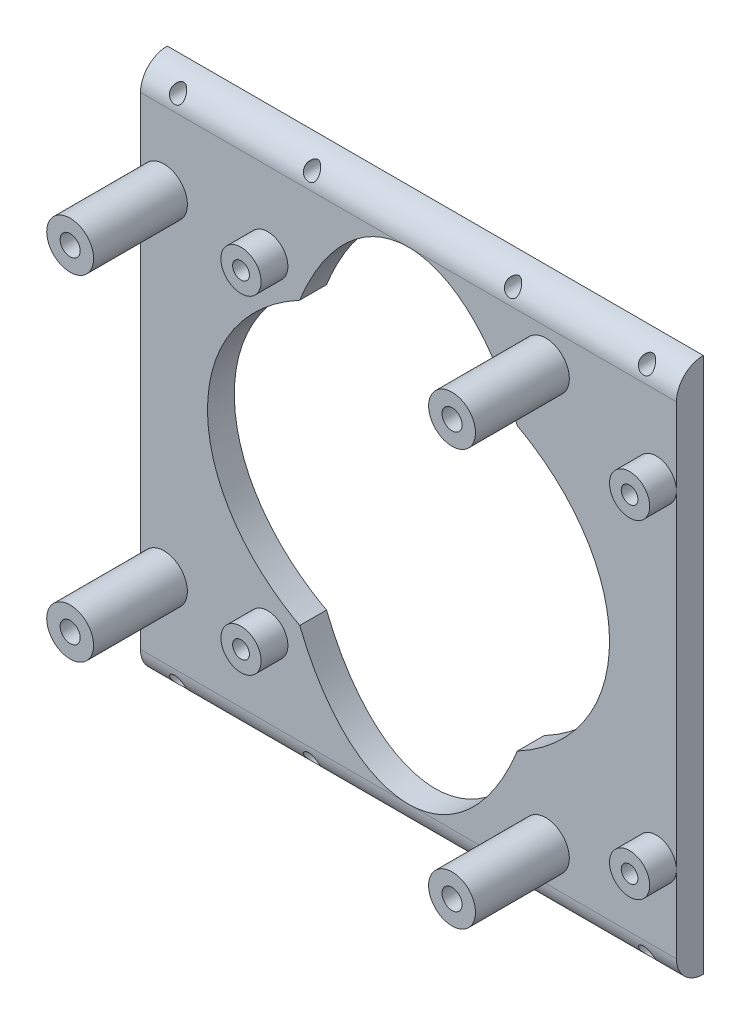
from build123d import *
from build123d.topology import SkipClean

# Parameters (mm, degrees)
CROQUIS1_W                 = 10
CROQUIS1_H                 = 10
CROQUIS1_R                 = 1.5
CROQUIS1_H_2               = 4
CROQUIS1_R_2               = 3
CROQUIS1_R_3               = 1.25
CROQUIS1_R_4               = 3.5
CROQUIS1_R_5               = 2.2
SALIENTE_EXTRUIR5_DEPTH    = 4
SALIENTE_EXTRUIR6_START    = 4
CROQUIS1_6_W               = 10
CROQUIS1_6_H               = 4
SALIENTE_EXTRUIR6_DEPTH    = 20.4
SALIENTE_EXTRUIR7_START    = 24.4
CROQUIS1_7_W               = 10
CROQUIS1_7_H               = 4
CROQUIS1_7_R               = 3
CROQUIS1_7_R_2             = 3.5
CROQUIS1_7_R_3             = 2.2
CROQUIS1_7_R_4             = 1.5
CROQUIS1_7_R_5             = 1.25
CROQUIS1_7_H_2             = 31
CROQUIS1_7_H_3             = 10
SALIENTE_EXTRUIR7_DEPTH    = 4
SALIENTE_EXTRUIR9_START    = 28.4
CROQUIS1_10_R              = 3
SALIENTE_EXTRUIR9_DEPTH    = 4
SALIENTE_EXTRUIR10_START   = 28.4
CROQUIS1_11_R              = 3.5
SALIENTE_EXTRUIR10_DEPTH   = 14
CORTAR_EXTRUIR1_DEPTH      = 14
CORTAR_EXTRUIR1_DEPTH_BACK = 14
CORTAR_EXTRUIR1_START      = 28.4
CROQUIS1_12_R              = 1.5
CROQUIS1_12_R_2            = 1.25
CORTAR_EXTRUIR2_START      = 24.4
CROQUIS1_13_R              = 2.2
CORTAR_EXTRUIR2_DEPTH      = 15
REDONDEO2_RADIUS           = 5
REDONDEO2_LENGTH           = 4
REDONDEO3_RADIUS           = 5
REDONDEO3_LENGTH           = 4
REDONDEO4_RADIUS           = 5
REDONDEO4_LENGTH           = 4
REDONDEO5_RADIUS           = 5
REDONDEO5_LENGTH           = 4
REDONDEO6_R                = 4
REDONDEO7_R                = 4
CORTAR_EXTRUIR6_START      = 28.4
CROQUIS2_RX                = 30
CROQUIS2_RY                = 25
CROQUIS2_RX_2              = 36
CROQUIS2_RY_2              = 20
CORTAR_EXTRUIR6_DEPTH      = 8
CORTAR_EXTRUIR7_DEPTH      = 10
CORTAR_EXTRUIR7_DEPTH_BACK = 90
CROQUIS3_W                 = 80
CROQUIS3_H                 = 24.4
CROQUIS4_R                 = 1.1
CORTAR_EXTRUIR8_DEPTH      = 17


with BuildPart() as part:
    # Croquis1 → Saliente-Extruir5 (new body)
    # profile 1 of 42: a face of its own
    with SkipClean():  # the faces are left unmerged after this step: merging them gives an invalid solid
        with BuildSketch(Plane.XY):
            with Locations((-45.946521078, 63.070175439)):
                Rectangle(CROQUIS1_W, CROQUIS1_H)
            with Locations((-45.946521078, 63.070175439)):
                Circle(CROQUIS1_R, mode=Mode.SUBTRACT)
        # profile 2 of 42: a face of its own
        with BuildSketch(Plane.XY):
            with Locations((24.053478922, 63.070175439)):
                Rectangle(CROQUIS1_W, CROQUIS1_H)
            with Locations((24.053478922, 63.070175439)):
                Circle(CROQUIS1_R, mode=Mode.SUBTRACT)
        # profile 3 of 42: a face of its own
        with BuildSketch(Plane.XY):
            with Locations((24.053478922, -26.929824561)):
                Rectangle(CROQUIS1_W, CROQUIS1_H)
            with Locations((24.053478922, -26.929824561)):
                Circle(CROQUIS1_R, mode=Mode.SUBTRACT)
        # profile 4 of 42: a face of its own
        with BuildSketch(Plane.XY):
            with Locations((-45.946521078, -26.929824561)):
                Rectangle(CROQUIS1_W, CROQUIS1_H)
            with Locations((-45.946521078, -26.929824561)):
                Circle(CROQUIS1_R, mode=Mode.SUBTRACT)
        # profile 5 of 42: a face of its own
        with BuildSketch(Plane.XY):
            with Locations((-45.946521078, -19.929824561)):
                Rectangle(CROQUIS1_W, CROQUIS1_H_2)
        # profile 6 of 42: a face of its own
        with BuildSketch(Plane.XY):
            with Locations((-35.946521078, -19.929824561)):
                Rectangle(CROQUIS1_W, CROQUIS1_H_2)
        # profile 7 of 42: a face of its own
        with BuildSketch(Plane.XY):
            with Locations((-25.946521078, -19.929824561)):
                Rectangle(CROQUIS1_W, CROQUIS1_H_2)
        # profile 8 of 42: a face of its own
        with BuildSketch(Plane.XY):
            with Locations((-15.946521078, -19.929824561)):
                Rectangle(CROQUIS1_W, CROQUIS1_H_2)
        # profile 9 of 42: a face of its own
        with BuildSketch(Plane.XY):
            with Locations((-5.946521078, -19.929824561)):
                Rectangle(CROQUIS1_W, CROQUIS1_H_2)
        # profile 10 of 42: a face of its own
        with BuildSketch(Plane.XY):
            with Locations((4.053478922, -19.929824561)):
                Rectangle(CROQUIS1_W, CROQUIS1_H_2)
        # profile 11 of 42: a face of its own
        with BuildSketch(Plane.XY):
            with Locations((14.053478922, -19.929824561)):
                Rectangle(CROQUIS1_W, CROQUIS1_H_2)
        # profile 12 of 42: a face of its own
        with BuildSketch(Plane.XY):
            with Locations((24.053478922, -19.929824561)):
                Rectangle(CROQUIS1_W, CROQUIS1_H_2)
        # profile 13 of 42: a face of its own
        with BuildSketch(Plane.XY):
            Polygon((29.053478922, 13.070175439), (19.053478922, 13.070175439), (19.053478922, -17.929824561), (29.053478922, -17.929824561), (29.053478922, -6.429824561), align=None)
            with Locations((26.053478922, -6.429824561)):
                Circle(CROQUIS1_R_2, mode=Mode.SUBTRACT)
        # profile 14 of 42: a face of its own
        with BuildSketch(Plane.XY):
            with Locations((26.053478922, -6.429824561)):
                Circle(CROQUIS1_R_2)
            with Locations((26.053478922, -6.429824561)):
                Circle(CROQUIS1_R_3, mode=Mode.SUBTRACT)
        # profile 15 of 42: a face of its own
        with BuildSketch(Plane.XY):
            with Locations((26.053478922, -6.429824561)):
                Circle(CROQUIS1_R_3)
        # profile 16 of 42: a face of its own
        with BuildSketch(Plane.XY):
            Polygon((-40.946521078, -17.929824561), (-40.946521078, 13.070175439), (-50.946521078, 13.070175439), (-50.946521078, -6.929824541), (-50.946521078, -17.929824561), align=None)
            with BuildLine():
                ThreePointArc((-43.946521078, -6.929824561), (-47.446521088, -10.429824561), (-50.946521078, -6.929824541))
                ThreePointArc((-50.946521078, -6.929824541), (-47.446521067, -3.429824561), (-43.946521078, -6.929824561))
            make_face(mode=Mode.SUBTRACT)
        # profile 17 of 42: a face of its own
        with BuildSketch(Plane.XY):
            with Locations((-47.446521078, -6.929824561)):
                Circle(CROQUIS1_R_4)
            with Locations((-47.446521078, -6.929824561)):
                Circle(CROQUIS1_R_5, mode=Mode.SUBTRACT)
        # profile 18 of 42: a face of its own
        with BuildSketch(Plane.XY):
            with Locations((-47.446521078, -6.929824561)):
                Circle(CROQUIS1_R_5)
            with Locations((-47.446521078, -6.929824561)):
                Circle(CROQUIS1_R, mode=Mode.SUBTRACT)
        # profile 19 of 42: a face of its own
        with BuildSketch(Plane.XY):
            with Locations((-47.446521078, -6.929824561)):
                Circle(CROQUIS1_R)
        # profile 20 of 42: a face of its own
        with BuildSketch(Plane.XY):
            with Locations((-45.946521078, 18.070175439)):
                Rectangle(CROQUIS1_W, CROQUIS1_H)
        # profile 21 of 42: a face of its own
        with BuildSketch(Plane.XY):
            with Locations((-35.946521078, 18.070175439)):
                Rectangle(CROQUIS1_W, CROQUIS1_H)
        # profile 22 of 42: a face of its own
        with BuildSketch(Plane.XY):
            with Locations((-25.946521078, 18.070175439)):
                Rectangle(CROQUIS1_W, CROQUIS1_H)
        # profile 23 of 42: a face of its own
        with BuildSketch(Plane.XY):
            with Locations((-15.946521078, 18.070175439)):
                Rectangle(CROQUIS1_W, CROQUIS1_H)
        # profile 24 of 42: a face of its own
        with BuildSketch(Plane.XY):
            with Locations((-5.946521078, 18.070175439)):
                Rectangle(CROQUIS1_W, CROQUIS1_H)
        # profile 25 of 42: a face of its own
        with BuildSketch(Plane.XY):
            with Locations((4.053478922, 18.070175439)):
                Rectangle(CROQUIS1_W, CROQUIS1_H)
        # profile 26 of 42: a face of its own
        with BuildSketch(Plane.XY):
            with Locations((14.053478922, 18.070175439)):
                Rectangle(CROQUIS1_W, CROQUIS1_H)
        # profile 27 of 42: a face of its own
        with BuildSketch(Plane.XY):
            with Locations((24.053478922, 18.070175439)):
                Rectangle(CROQUIS1_W, CROQUIS1_H)
        # profile 28 of 42: a face of its own
        with BuildSketch(Plane.XY):
            Polygon((-40.946521078, 54.070175439), (-50.946521078, 54.070175439), (-50.946521078, 43.070175439), (-50.946521078, 23.070175439), (-40.946521078, 23.070175439), align=None)
            with BuildLine():
                ThreePointArc((-43.946521078, 43.070175439), (-47.446521078, 39.570175439), (-50.946521078, 43.070175439))
                ThreePointArc((-50.946521078, 43.070175439), (-47.446521078, 46.570175439), (-43.946521078, 43.070175439))
            make_face(mode=Mode.SUBTRACT)
        # profile 29 of 42: a face of its own
        with BuildSketch(Plane.XY):
            with Locations((-45.946521078, 56.070175439)):
                Rectangle(CROQUIS1_W, CROQUIS1_H_2)
        # profile 30 of 42: a face of its own
        with BuildSketch(Plane.XY):
            with Locations((-47.446521078, 43.070175439)):
                Circle(CROQUIS1_R_4)
            with Locations((-47.446521078, 43.070175439)):
                Circle(CROQUIS1_R_5, mode=Mode.SUBTRACT)
        # profile 31 of 42: a face of its own
        with BuildSketch(Plane.XY):
            with Locations((-47.446521078, 43.070175439)):
                Circle(CROQUIS1_R_5)
            with Locations((-47.446521078, 43.070175439)):
                Circle(CROQUIS1_R, mode=Mode.SUBTRACT)
        # profile 32 of 42: a face of its own
        with BuildSketch(Plane.XY):
            with Locations((-47.446521078, 43.070175439)):
                Circle(CROQUIS1_R)
        # profile 33 of 42: a face of its own
        with BuildSketch(Plane.XY):
            with Locations((-35.946521078, 56.070175439)):
                Rectangle(CROQUIS1_W, CROQUIS1_H_2)
        # profile 34 of 42: a face of its own
        with BuildSketch(Plane.XY):
            with Locations((-25.946521078, 56.070175439)):
                Rectangle(CROQUIS1_W, CROQUIS1_H_2)
        # profile 35 of 42: a face of its own
        with BuildSketch(Plane.XY):
            with Locations((-15.946521078, 56.070175439)):
                Rectangle(CROQUIS1_W, CROQUIS1_H_2)
        # profile 36 of 42: a face of its own
        with BuildSketch(Plane.XY):
            with Locations((-5.946521078, 56.070175439)):
                Rectangle(CROQUIS1_W, CROQUIS1_H_2)
        # profile 37 of 42: a face of its own
        with BuildSketch(Plane.XY):
            with Locations((4.053478922, 56.070175439)):
                Rectangle(CROQUIS1_W, CROQUIS1_H_2)
        # profile 38 of 42: a face of its own
        with BuildSketch(Plane.XY):
            with Locations((14.053478922, 56.070175439)):
                Rectangle(CROQUIS1_W, CROQUIS1_H_2)
        # profile 39 of 42: a face of its own
        with BuildSketch(Plane.XY):
            with Locations((24.053478922, 56.070175439)):
                Rectangle(CROQUIS1_W, CROQUIS1_H_2)
        # profile 40 of 42: a face of its own
        with BuildSketch(Plane.XY):
            Polygon((29.053478922, 54.070175439), (19.053478922, 54.070175439), (19.053478922, 23.070175439), (29.053478922, 23.070175439), (29.053478922, 42.570175439), align=None)
            with Locations((26.053478922, 42.570175439)):
                Circle(CROQUIS1_R_2, mode=Mode.SUBTRACT)
        # profile 41 of 42: a face of its own
        with BuildSketch(Plane.XY):
            with Locations((26.053478922, 42.570175439)):
                Circle(CROQUIS1_R_2)
            with Locations((26.053478922, 42.570175439)):
                Circle(CROQUIS1_R_3, mode=Mode.SUBTRACT)
        # profile 42 of 42: a face of its own
        with BuildSketch(Plane.XY):
            with Locations((26.053478922, 42.570175439)):
                Circle(CROQUIS1_R_3)
        extrude(amount=SALIENTE_EXTRUIR5_DEPTH)

    # Croquis1<6> → Saliente-Extruir6 (add)
    with BuildSketch(Plane.XY.offset(SALIENTE_EXTRUIR6_START)):
        with Locations((-45.946521078, 56.070175439)):
            Rectangle(CROQUIS1_6_W, CROQUIS1_6_H)
        with Locations((-25.946521078, 56.070175439)):
            Rectangle(CROQUIS1_6_W, CROQUIS1_6_H)
        with Locations((24.053478922, 56.070175439)):
            Rectangle(CROQUIS1_6_W, CROQUIS1_6_H)
        with Locations((4.053478922, 56.070175439)):
            Rectangle(CROQUIS1_6_W, CROQUIS1_6_H)
        with Locations((-45.946521078, -19.929824561)):
            Rectangle(CROQUIS1_6_W, CROQUIS1_6_H)
        with Locations((-25.946521078, -19.929824561)):
            Rectangle(CROQUIS1_6_W, CROQUIS1_6_H)
        with Locations((4.053478922, -19.929824561)):
            Rectangle(CROQUIS1_6_W, CROQUIS1_6_H)
        with Locations((24.053478922, -19.929824561)):
            Rectangle(CROQUIS1_6_W, CROQUIS1_6_H)
    extrude(amount=SALIENTE_EXTRUIR6_DEPTH)

    # Croquis1<7> → Saliente-Extruir7 (add)
    # profile 1 of 90: a face of its own
    with SkipClean():  # the faces are left unmerged after this step: merging them gives an invalid solid
        with BuildSketch(Plane.XY.offset(SALIENTE_EXTRUIR7_START)):
            with Locations((-45.946521078, 56.070175439)):
                Rectangle(CROQUIS1_7_W, CROQUIS1_7_H)
        # profile 2 of 90: a face of its own
        with BuildSketch(Plane.XY.offset(SALIENTE_EXTRUIR7_START)):
            with Locations((-35.946521078, 56.070175439)):
                Rectangle(CROQUIS1_7_W, CROQUIS1_7_H)
        # profile 3 of 90: a face of its own
        with BuildSketch(Plane.XY.offset(SALIENTE_EXTRUIR7_START)):
            with Locations((-15.946521078, 56.070175439)):
                Rectangle(CROQUIS1_7_W, CROQUIS1_7_H)
        # profile 4 of 90: a face of its own
        with BuildSketch(Plane.XY.offset(SALIENTE_EXTRUIR7_START)):
            with Locations((-5.946521078, 56.070175439)):
                Rectangle(CROQUIS1_7_W, CROQUIS1_7_H)
        # profile 5 of 90: a face of its own
        with BuildSketch(Plane.XY.offset(SALIENTE_EXTRUIR7_START)):
            with Locations((4.053478922, 56.070175439)):
                Rectangle(CROQUIS1_7_W, CROQUIS1_7_H)
        # profile 6 of 90: a face of its own
        with BuildSketch(Plane.XY.offset(SALIENTE_EXTRUIR7_START)):
            with Locations((-25.946521078, 56.070175439)):
                Rectangle(CROQUIS1_7_W, CROQUIS1_7_H)
        # profile 7 of 90: a face of its own
        with BuildSketch(Plane.XY.offset(SALIENTE_EXTRUIR7_START)):
            with Locations((14.053478922, 56.070175439)):
                Rectangle(CROQUIS1_7_W, CROQUIS1_7_H)
        # profile 8 of 90: a face of its own
        with BuildSketch(Plane.XY.offset(SALIENTE_EXTRUIR7_START)):
            Polygon((29.053478922, 54.070175439), (19.053478922, 54.070175439), (19.053478922, 23.070175439), (29.053478922, 23.070175439), (29.053478922, 42.570175439), align=None)
            with Locations((26.053478922, 42.570175439)):
                Circle(CROQUIS1_7_R, mode=Mode.SUBTRACT)
        # profile 9 of 90: a face of its own
        with BuildSketch(Plane.XY.offset(SALIENTE_EXTRUIR7_START)):
            Polygon((-40.946521078, 54.070175439), (-50.946521078, 54.070175439), (-50.946521078, 43.070175439), (-50.946521078, 23.070175439), (-40.946521078, 23.070175439), align=None)
            with BuildLine():
                ThreePointArc((-43.946521078, 43.070175439), (-47.446521078, 39.570175439), (-50.946521078, 43.070175439))
                ThreePointArc((-50.946521078, 43.070175439), (-47.446521078, 46.570175439), (-43.946521078, 43.070175439))
            make_face(mode=Mode.SUBTRACT)
        # profile 10 of 90: a face of its own
        with BuildSketch(Plane.XY.offset(SALIENTE_EXTRUIR7_START)):
            with BuildLine():
                Line((-30.946521078, 54.070175439), (-40.946521078, 54.070175439))
                Line((-40.946521078, 54.070175439), (-40.946521078, 23.070175439))
                Line((-40.946521078, 23.070175439), (-30.946521078, 23.070175439))
                Line((-30.946521078, 23.070175439), (-30.946521078, 39.741748314))
                ThreePointArc((-30.946521078, 39.741748314), (-34.946521078, 42.570175439), (-30.946521078, 45.398602563))
                Line((-30.946521078, 45.398602563), (-30.946521078, 54.070175439))
            make_face()
        # profile 11 of 90: a face of its own
        with BuildSketch(Plane.XY.offset(SALIENTE_EXTRUIR7_START)):
            with Locations((-47.446521078, 43.070175439)):
                Circle(CROQUIS1_7_R_2)
            with Locations((-47.446521078, 43.070175439)):
                Circle(CROQUIS1_7_R_3, mode=Mode.SUBTRACT)
        # profile 12 of 90: a face of its own
        with BuildSketch(Plane.XY.offset(SALIENTE_EXTRUIR7_START)):
            with Locations((-47.446521078, 43.070175439)):
                Circle(CROQUIS1_7_R_3)
            with Locations((-47.446521078, 43.070175439)):
                Circle(CROQUIS1_7_R_4, mode=Mode.SUBTRACT)
        # profile 13 of 90: a face of its own
        with BuildSketch(Plane.XY.offset(SALIENTE_EXTRUIR7_START)):
            with Locations((-47.446521078, 43.070175439)):
                Circle(CROQUIS1_7_R_4)
        # profile 14 of 90: a face of its own
        with BuildSketch(Plane.XY.offset(SALIENTE_EXTRUIR7_START)):
            with Locations((26.053478922, 42.570175439)):
                Circle(CROQUIS1_7_R)
            with Locations((26.053478922, 42.570175439)):
                Circle(CROQUIS1_7_R_5, mode=Mode.SUBTRACT)
        # profile 15 of 90: a face of its own
        with BuildSketch(Plane.XY.offset(SALIENTE_EXTRUIR7_START)):
            with Locations((26.053478922, 42.570175439)):
                Circle(CROQUIS1_7_R_5)
        # profile 16 of 90: a face of its own
        with BuildSketch(Plane.XY.offset(SALIENTE_EXTRUIR7_START)):
            with Locations((24.053478922, 56.070175439)):
                Rectangle(CROQUIS1_7_W, CROQUIS1_7_H)
        # profile 17 of 90: a face of its own
        with BuildSketch(Plane.XY.offset(SALIENTE_EXTRUIR7_START)):
            with BuildLine():
                ThreePointArc((-28.946521078, 42.570175439), (-29.497031335, 44.302226246), (-30.946521078, 45.398602563))
                Line((-30.946521078, 45.398602563), (-30.946521078, 43.320175439))
                ThreePointArc((-30.946521078, 43.320175439), (-30.760666955, 42.965460146), (-30.696521078, 42.570175439))
                ThreePointArc((-30.696521078, 42.570175439), (-30.760666955, 42.174890731), (-30.946521078, 41.820175439))
                Line((-30.946521078, 41.820175439), (-30.946521078, 39.741748314))
                ThreePointArc((-30.946521078, 39.741748314), (-29.497031335, 40.838124631), (-28.946521078, 42.570175439))
            make_face()
        # profile 18 of 90: a face of its own
        with BuildSketch(Plane.XY.offset(SALIENTE_EXTRUIR7_START)):
            with BuildLine():
                Line((-30.946521078, 43.320175439), (-30.946521078, 45.398602563))
                ThreePointArc((-30.946521078, 45.398602563), (-34.946521078, 42.570175439), (-30.946521078, 39.741748314))
                Line((-30.946521078, 39.741748314), (-30.946521078, 41.820175439))
                ThreePointArc((-30.946521078, 41.820175439), (-33.196521078, 42.570175439), (-30.946521078, 43.320175439))
            make_face()
        # profile 19 of 90: a face of its own
        with BuildSketch(Plane.XY.offset(SALIENTE_EXTRUIR7_START)):
            with BuildLine():
                ThreePointArc((-30.696521078, 42.570175439), (-30.760666955, 42.965460146), (-30.946521078, 43.320175439))
                Line((-30.946521078, 43.320175439), (-30.946521078, 41.820175439))
                ThreePointArc((-30.946521078, 41.820175439), (-30.760666955, 42.174890731), (-30.696521078, 42.570175439))
            make_face()
        # profile 20 of 90: a face of its own
        with BuildSketch(Plane.XY.offset(SALIENTE_EXTRUIR7_START)):
            with BuildLine():
                Line((-30.946521078, 41.820175439), (-30.946521078, 43.320175439))
                ThreePointArc((-30.946521078, 43.320175439), (-33.196521078, 42.570175439), (-30.946521078, 41.820175439))
            make_face()
        # profile 21 of 90: a face of its own
        with BuildSketch(Plane.XY.offset(SALIENTE_EXTRUIR7_START)):
            with BuildLine():
                ThreePointArc((-28.946521078, 42.570175439), (-29.497031335, 44.302226246), (-30.946521078, 45.398602563))
                Line((-30.946521078, 45.398602563), (-30.946521078, 43.320175439))
                ThreePointArc((-30.946521078, 43.320175439), (-30.760666955, 42.965460146), (-30.696521078, 42.570175439))
                ThreePointArc((-30.696521078, 42.570175439), (-30.760666955, 42.174890731), (-30.946521078, 41.820175439))
                Line((-30.946521078, 41.820175439), (-30.946521078, 39.741748314))
                ThreePointArc((-30.946521078, 39.741748314), (-29.497031335, 40.838124631), (-28.946521078, 42.570175439))
            make_face()
        # profile 22 of 90: a face of its own
        with BuildSketch(Plane.XY.offset(SALIENTE_EXTRUIR7_START)):
            with BuildLine():
                Line((-30.946521078, 43.320175439), (-30.946521078, 45.398602563))
                ThreePointArc((-30.946521078, 45.398602563), (-34.946521078, 42.570175439), (-30.946521078, 39.741748314))
                Line((-30.946521078, 39.741748314), (-30.946521078, 41.820175439))
                ThreePointArc((-30.946521078, 41.820175439), (-33.196521078, 42.570175439), (-30.946521078, 43.320175439))
            make_face()
        # profile 23 of 90: a face of its own
        with BuildSketch(Plane.XY.offset(SALIENTE_EXTRUIR7_START)):
            with BuildLine():
                ThreePointArc((-30.696521078, 42.570175439), (-30.760666955, 42.965460146), (-30.946521078, 43.320175439))
                Line((-30.946521078, 43.320175439), (-30.946521078, 41.820175439))
                ThreePointArc((-30.946521078, 41.820175439), (-30.760666955, 42.174890731), (-30.696521078, 42.570175439))
            make_face()
        # profile 24 of 90: a face of its own
        with BuildSketch(Plane.XY.offset(SALIENTE_EXTRUIR7_START)):
            with BuildLine():
                Line((-30.946521078, 41.820175439), (-30.946521078, 43.320175439))
                ThreePointArc((-30.946521078, 43.320175439), (-33.196521078, 42.570175439), (-30.946521078, 41.820175439))
            make_face()
        # profile 25 of 90: a face of its own
        with BuildSketch(Plane.XY.offset(SALIENTE_EXTRUIR7_START)):
            with BuildLine():
                Line((-20.946521078, 54.070175439), (-30.946521078, 54.070175439))
                Line((-30.946521078, 54.070175439), (-30.946521078, 45.398602563))
                ThreePointArc((-30.946521078, 45.398602563), (-29.497031335, 44.302226246), (-28.946521078, 42.570175439))
                ThreePointArc((-28.946521078, 42.570175439), (-29.497031335, 40.838124631), (-30.946521078, 39.741748314))
                Line((-30.946521078, 39.741748314), (-30.946521078, 23.070175439))
                Line((-30.946521078, 23.070175439), (-20.946521078, 23.070175439))
                Line((-20.946521078, 23.070175439), (-20.946521078, 54.070175439))
            make_face()
        # profile 26 of 90: a face of its own
        with BuildSketch(Plane.XY.offset(SALIENTE_EXTRUIR7_START)):
            with Locations((-15.946521078, 38.570175439)):
                Rectangle(CROQUIS1_7_W, CROQUIS1_7_H_2)
        # profile 27 of 90: a face of its own
        with BuildSketch(Plane.XY.offset(SALIENTE_EXTRUIR7_START)):
            with Locations((-5.946521078, 38.570175439)):
                Rectangle(CROQUIS1_7_W, CROQUIS1_7_H_2)
        # profile 28 of 90: a face of its own
        with BuildSketch(Plane.XY.offset(SALIENTE_EXTRUIR7_START)):
            with BuildLine():
                Line((9.053478922, 54.070175439), (-0.946521078, 54.070175439))
                Line((-0.946521078, 54.070175439), (-0.946521078, 23.070175439))
                Line((-0.946521078, 23.070175439), (9.053478922, 23.070175439))
                Line((9.053478922, 23.070175439), (9.053478922, 45.606073823))
                ThreePointArc((9.053478922, 45.606073823), (6.053478922, 49.070175439), (9.053478922, 52.534277054))
                Line((9.053478922, 52.534277054), (9.053478922, 54.070175439))
            make_face()
        # profile 29 of 90: a face of its own
        with BuildSketch(Plane.XY.offset(SALIENTE_EXTRUIR7_START)):
            with BuildLine():
                ThreePointArc((13.053478922, 49.070175439), (11.84476677, 51.71592675), (9.053478922, 52.534277054))
                Line((9.053478922, 52.534277054), (9.053478922, 51.212603967))
                ThreePointArc((9.053478922, 51.212603967), (10.920958355, 50.793544233), (11.753478922, 49.070175439))
                ThreePointArc((11.753478922, 49.070175439), (10.920958355, 47.346806645), (9.053478922, 46.92774691))
                Line((9.053478922, 46.92774691), (9.053478922, 45.606073823))
                ThreePointArc((9.053478922, 45.606073823), (11.84476677, 46.424424128), (13.053478922, 49.070175439))
            make_face()
        # profile 30 of 90: a face of its own
        with BuildSketch(Plane.XY.offset(SALIENTE_EXTRUIR7_START)):
            with BuildLine():
                Line((9.053478922, 51.212603967), (9.053478922, 52.534277054))
                ThreePointArc((9.053478922, 52.534277054), (6.053478922, 49.070175439), (9.053478922, 45.606073823))
                Line((9.053478922, 45.606073823), (9.053478922, 46.92774691))
                ThreePointArc((9.053478922, 46.92774691), (7.353478922, 49.070175439), (9.053478922, 51.212603967))
            make_face()
        # profile 31 of 90: a face of its own
        with BuildSketch(Plane.XY.offset(SALIENTE_EXTRUIR7_START)):
            with BuildLine():
                ThreePointArc((11.753478922, 49.070175439), (10.920958355, 50.793544233), (9.053478922, 51.212603967))
                Line((9.053478922, 51.212603967), (9.053478922, 50.484389001))
                ThreePointArc((9.053478922, 50.484389001), (10.419504326, 50.29492031), (11.053478922, 49.070175439))
                ThreePointArc((11.053478922, 49.070175439), (10.419504326, 47.845430567), (9.053478922, 47.655961876))
                Line((9.053478922, 47.655961876), (9.053478922, 46.92774691))
                ThreePointArc((9.053478922, 46.92774691), (10.920958355, 47.346806645), (11.753478922, 49.070175439))
            make_face()
        # profile 32 of 90: a face of its own
        with BuildSketch(Plane.XY.offset(SALIENTE_EXTRUIR7_START)):
            with BuildLine():
                Line((9.053478922, 50.484389001), (9.053478922, 51.212603967))
                ThreePointArc((9.053478922, 51.212603967), (7.353478922, 49.070175439), (9.053478922, 46.92774691))
                Line((9.053478922, 46.92774691), (9.053478922, 47.655961876))
                ThreePointArc((9.053478922, 47.655961876), (8.053478922, 49.070175439), (9.053478922, 50.484389001))
            make_face()
        # profile 33 of 90: a face of its own
        with BuildSketch(Plane.XY.offset(SALIENTE_EXTRUIR7_START)):
            with BuildLine():
                ThreePointArc((11.053478922, 49.070175439), (10.419504326, 50.29492031), (9.053478922, 50.484389001))
                Line((9.053478922, 50.484389001), (9.053478922, 47.655961876))
                ThreePointArc((9.053478922, 47.655961876), (10.419504326, 47.845430567), (11.053478922, 49.070175439))
            make_face()
        # profile 34 of 90: a face of its own
        with BuildSketch(Plane.XY.offset(SALIENTE_EXTRUIR7_START)):
            with BuildLine():
                Line((9.053478922, 47.655961876), (9.053478922, 50.484389001))
                ThreePointArc((9.053478922, 50.484389001), (8.053478922, 49.070175439), (9.053478922, 47.655961876))
            make_face()
        # profile 35 of 90: a face of its own
        with BuildSketch(Plane.XY.offset(SALIENTE_EXTRUIR7_START)):
            with BuildLine():
                ThreePointArc((11.053478922, 49.070175439), (10.419504326, 50.29492031), (9.053478922, 50.484389001))
                Line((9.053478922, 50.484389001), (9.053478922, 47.655961876))
                ThreePointArc((9.053478922, 47.655961876), (10.419504326, 47.845430567), (11.053478922, 49.070175439))
            make_face()
        # profile 36 of 90: a face of its own
        with BuildSketch(Plane.XY.offset(SALIENTE_EXTRUIR7_START)):
            with BuildLine():
                Line((9.053478922, 47.655961876), (9.053478922, 50.484389001))
                ThreePointArc((9.053478922, 50.484389001), (8.053478922, 49.070175439), (9.053478922, 47.655961876))
            make_face()
        # profile 37 of 90: a face of its own
        with BuildSketch(Plane.XY.offset(SALIENTE_EXTRUIR7_START)):
            with BuildLine():
                ThreePointArc((11.753478922, 49.070175439), (10.920958355, 50.793544233), (9.053478922, 51.212603967))
                Line((9.053478922, 51.212603967), (9.053478922, 50.484389001))
                ThreePointArc((9.053478922, 50.484389001), (10.419504326, 50.29492031), (11.053478922, 49.070175439))
                ThreePointArc((11.053478922, 49.070175439), (10.419504326, 47.845430567), (9.053478922, 47.655961876))
                Line((9.053478922, 47.655961876), (9.053478922, 46.92774691))
                ThreePointArc((9.053478922, 46.92774691), (10.920958355, 47.346806645), (11.753478922, 49.070175439))
            make_face()
        # profile 38 of 90: a face of its own
        with BuildSketch(Plane.XY.offset(SALIENTE_EXTRUIR7_START)):
            with BuildLine():
                Line((9.053478922, 50.484389001), (9.053478922, 51.212603967))
                ThreePointArc((9.053478922, 51.212603967), (7.353478922, 49.070175439), (9.053478922, 46.92774691))
                Line((9.053478922, 46.92774691), (9.053478922, 47.655961876))
                ThreePointArc((9.053478922, 47.655961876), (8.053478922, 49.070175439), (9.053478922, 50.484389001))
            make_face()
        # profile 39 of 90: a face of its own
        with BuildSketch(Plane.XY.offset(SALIENTE_EXTRUIR7_START)):
            with BuildLine():
                ThreePointArc((13.053478922, 49.070175439), (11.84476677, 51.71592675), (9.053478922, 52.534277054))
                Line((9.053478922, 52.534277054), (9.053478922, 51.212603967))
                ThreePointArc((9.053478922, 51.212603967), (10.920958355, 50.793544233), (11.753478922, 49.070175439))
                ThreePointArc((11.753478922, 49.070175439), (10.920958355, 47.346806645), (9.053478922, 46.92774691))
                Line((9.053478922, 46.92774691), (9.053478922, 45.606073823))
                ThreePointArc((9.053478922, 45.606073823), (11.84476677, 46.424424128), (13.053478922, 49.070175439))
            make_face()
        # profile 40 of 90: a face of its own
        with BuildSketch(Plane.XY.offset(SALIENTE_EXTRUIR7_START)):
            with BuildLine():
                Line((9.053478922, 51.212603967), (9.053478922, 52.534277054))
                ThreePointArc((9.053478922, 52.534277054), (6.053478922, 49.070175439), (9.053478922, 45.606073823))
                Line((9.053478922, 45.606073823), (9.053478922, 46.92774691))
                ThreePointArc((9.053478922, 46.92774691), (7.353478922, 49.070175439), (9.053478922, 51.212603967))
            make_face()
        # profile 41 of 90: a face of its own
        with BuildSketch(Plane.XY.offset(SALIENTE_EXTRUIR7_START)):
            with BuildLine():
                Line((19.053478922, 54.070175439), (9.053478922, 54.070175439))
                Line((9.053478922, 54.070175439), (9.053478922, 52.534277054))
                ThreePointArc((9.053478922, 52.534277054), (11.84476677, 51.71592675), (13.053478922, 49.070175439))
                ThreePointArc((13.053478922, 49.070175439), (11.84476677, 46.424424128), (9.053478922, 45.606073823))
                Line((9.053478922, 45.606073823), (9.053478922, 23.070175439))
                Line((9.053478922, 23.070175439), (19.053478922, 23.070175439))
                Line((19.053478922, 23.070175439), (19.053478922, 54.070175439))
            make_face()
        # profile 42 of 90: a face of its own
        with BuildSketch(Plane.XY.offset(SALIENTE_EXTRUIR7_START)):
            with Locations((24.053478922, 18.070175439)):
                Rectangle(CROQUIS1_7_W, CROQUIS1_7_H_3)
        # profile 43 of 90: a face of its own
        with BuildSketch(Plane.XY.offset(SALIENTE_EXTRUIR7_START)):
            with Locations((14.053478922, 18.070175439)):
                Rectangle(CROQUIS1_7_W, CROQUIS1_7_H_3)
        # profile 44 of 90: a face of its own
        with BuildSketch(Plane.XY.offset(SALIENTE_EXTRUIR7_START)):
            with Locations((4.053478922, 18.070175439)):
                Rectangle(CROQUIS1_7_W, CROQUIS1_7_H_3)
        # profile 45 of 90: a face of its own
        with BuildSketch(Plane.XY.offset(SALIENTE_EXTRUIR7_START)):
            with Locations((-5.946521078, 18.070175439)):
                Rectangle(CROQUIS1_7_W, CROQUIS1_7_H_3)
        # profile 46 of 90: a face of its own
        with BuildSketch(Plane.XY.offset(SALIENTE_EXTRUIR7_START)):
            with Locations((-15.946521078, 18.070175439)):
                Rectangle(CROQUIS1_7_W, CROQUIS1_7_H_3)
        # profile 47 of 90: a face of its own
        with BuildSketch(Plane.XY.offset(SALIENTE_EXTRUIR7_START)):
            with Locations((-25.946521078, 18.070175439)):
                Rectangle(CROQUIS1_7_W, CROQUIS1_7_H_3)
        # profile 48 of 90: a face of its own
        with BuildSketch(Plane.XY.offset(SALIENTE_EXTRUIR7_START)):
            with Locations((-35.946521078, 18.070175439)):
                Rectangle(CROQUIS1_7_W, CROQUIS1_7_H_3)
        # profile 49 of 90: a face of its own
        with BuildSketch(Plane.XY.offset(SALIENTE_EXTRUIR7_START)):
            with Locations((-45.946521078, 18.070175439)):
                Rectangle(CROQUIS1_7_W, CROQUIS1_7_H_3)
        # profile 50 of 90: a face of its own
        with BuildSketch(Plane.XY.offset(SALIENTE_EXTRUIR7_START)):
            with BuildLine():
                Line((-30.946521078, 13.070175439), (-40.946521078, 13.070175439))
                Line((-40.946521078, 13.070175439), (-40.946521078, -17.929824561))
                Line((-40.946521078, -17.929824561), (-30.946521078, -17.929824561))
                Line((-30.946521078, -17.929824561), (-30.946521078, -9.258251686))
                ThreePointArc((-30.946521078, -9.258251686), (-34.946521078, -6.429824561), (-30.946521078, -3.601397437))
                Line((-30.946521078, -3.601397437), (-30.946521078, 13.070175439))
            make_face()
        # profile 51 of 90: a face of its own
        with BuildSketch(Plane.XY.offset(SALIENTE_EXTRUIR7_START)):
            with BuildLine():
                Line((-20.946521078, 13.070175439), (-30.946521078, 13.070175439))
                Line((-30.946521078, 13.070175439), (-30.946521078, -3.601397437))
                ThreePointArc((-30.946521078, -3.601397437), (-29.497031335, -4.697773754), (-28.946521078, -6.429824561))
                ThreePointArc((-28.946521078, -6.429824561), (-29.497031335, -8.161875369), (-30.946521078, -9.258251686))
                Line((-30.946521078, -9.258251686), (-30.946521078, -17.929824561))
                Line((-30.946521078, -17.929824561), (-20.946521078, -17.929824561))
                Line((-20.946521078, -17.929824561), (-20.946521078, 13.070175439))
            make_face()
        # profile 52 of 90: a face of its own
        with BuildSketch(Plane.XY.offset(SALIENTE_EXTRUIR7_START)):
            with Locations((-15.946521078, -2.429824561)):
                Rectangle(CROQUIS1_7_W, CROQUIS1_7_H_2)
        # profile 53 of 90: a face of its own
        with BuildSketch(Plane.XY.offset(SALIENTE_EXTRUIR7_START)):
            with Locations((-5.946521078, -2.429824561)):
                Rectangle(CROQUIS1_7_W, CROQUIS1_7_H_2)
        # profile 54 of 90: a face of its own
        with BuildSketch(Plane.XY.offset(SALIENTE_EXTRUIR7_START)):
            with BuildLine():
                Line((9.053478922, 13.070175439), (-0.946521078, 13.070175439))
                Line((-0.946521078, 13.070175439), (-0.946521078, -17.929824561))
                Line((-0.946521078, -17.929824561), (9.053478922, -17.929824561))
                Line((9.053478922, -17.929824561), (9.053478922, -16.393926177))
                ThreePointArc((9.053478922, -16.393926177), (6.053478922, -12.929824561), (9.053478922, -9.465722946))
                Line((9.053478922, -9.465722946), (9.053478922, 13.070175439))
            make_face()
        # profile 55 of 90: a face of its own
        with BuildSketch(Plane.XY.offset(SALIENTE_EXTRUIR7_START)):
            with BuildLine():
                Line((19.053478922, 13.070175439), (9.053478922, 13.070175439))
                Line((9.053478922, 13.070175439), (9.053478922, -9.465722946))
                ThreePointArc((9.053478922, -9.465722946), (11.84476677, -10.28407325), (13.053478922, -12.929824561))
                ThreePointArc((13.053478922, -12.929824561), (11.84476677, -15.575575872), (9.053478922, -16.393926177))
                Line((9.053478922, -16.393926177), (9.053478922, -17.929824561))
                Line((9.053478922, -17.929824561), (19.053478922, -17.929824561))
                Line((19.053478922, -17.929824561), (19.053478922, 13.070175439))
            make_face()
        # profile 56 of 90: a face of its own
        with BuildSketch(Plane.XY.offset(SALIENTE_EXTRUIR7_START)):
            Polygon((-40.946521078, -17.929824561), (-40.946521078, 13.070175439), (-50.946521078, 13.070175439), (-50.946521078, -6.929824541), (-50.946521078, -17.929824561), align=None)
            with BuildLine():
                ThreePointArc((-43.946521078, -6.929824561), (-47.446521088, -10.429824561), (-50.946521078, -6.929824541))
                ThreePointArc((-50.946521078, -6.929824541), (-47.446521067, -3.429824561), (-43.946521078, -6.929824561))
            make_face(mode=Mode.SUBTRACT)
        # profile 57 of 90: a face of its own
        with BuildSketch(Plane.XY.offset(SALIENTE_EXTRUIR7_START)):
            with Locations((-47.446521078, -6.929824561)):
                Circle(CROQUIS1_7_R_2)
            with Locations((-47.446521078, -6.929824561)):
                Circle(CROQUIS1_7_R_3, mode=Mode.SUBTRACT)
        # profile 58 of 90: a face of its own
        with BuildSketch(Plane.XY.offset(SALIENTE_EXTRUIR7_START)):
            with Locations((-47.446521078, -6.929824561)):
                Circle(CROQUIS1_7_R_3)
            with Locations((-47.446521078, -6.929824561)):
                Circle(CROQUIS1_7_R_4, mode=Mode.SUBTRACT)
        # profile 59 of 90: a face of its own
        with BuildSketch(Plane.XY.offset(SALIENTE_EXTRUIR7_START)):
            with Locations((-47.446521078, -6.929824561)):
                Circle(CROQUIS1_7_R_4)
        # profile 60 of 90: a face of its own
        with BuildSketch(Plane.XY.offset(SALIENTE_EXTRUIR7_START)):
            with BuildLine():
                ThreePointArc((-28.946521078, -6.429824561), (-29.497031335, -4.697773754), (-30.946521078, -3.601397437))
                Line((-30.946521078, -3.601397437), (-30.946521078, -5.679824561))
                ThreePointArc((-30.946521078, -5.679824561), (-30.760666955, -6.034539854), (-30.696521078, -6.429824561))
                ThreePointArc((-30.696521078, -6.429824561), (-30.760666955, -6.825109269), (-30.946521078, -7.179824561))
                Line((-30.946521078, -7.179824561), (-30.946521078, -9.258251686))
                ThreePointArc((-30.946521078, -9.258251686), (-29.497031335, -8.161875369), (-28.946521078, -6.429824561))
            make_face()
        # profile 61 of 90: a face of its own
        with BuildSketch(Plane.XY.offset(SALIENTE_EXTRUIR7_START)):
            with BuildLine():
                Line((-30.946521078, -5.679824561), (-30.946521078, -3.601397437))
                ThreePointArc((-30.946521078, -3.601397437), (-34.946521078, -6.429824561), (-30.946521078, -9.258251686))
                Line((-30.946521078, -9.258251686), (-30.946521078, -7.179824561))
                ThreePointArc((-30.946521078, -7.179824561), (-33.196521078, -6.429824561), (-30.946521078, -5.679824561))
            make_face()
        # profile 62 of 90: a face of its own
        with BuildSketch(Plane.XY.offset(SALIENTE_EXTRUIR7_START)):
            with BuildLine():
                ThreePointArc((-30.696521078, -6.429824561), (-30.760666955, -6.034539854), (-30.946521078, -5.679824561))
                Line((-30.946521078, -5.679824561), (-30.946521078, -7.179824561))
                ThreePointArc((-30.946521078, -7.179824561), (-30.760666955, -6.825109269), (-30.696521078, -6.429824561))
            make_face()
        # profile 63 of 90: a face of its own
        with BuildSketch(Plane.XY.offset(SALIENTE_EXTRUIR7_START)):
            with BuildLine():
                Line((-30.946521078, -7.179824561), (-30.946521078, -5.679824561))
                ThreePointArc((-30.946521078, -5.679824561), (-33.196521078, -6.429824561), (-30.946521078, -7.179824561))
            make_face()
        # profile 64 of 90: a face of its own
        with BuildSketch(Plane.XY.offset(SALIENTE_EXTRUIR7_START)):
            with BuildLine():
                ThreePointArc((-30.696521078, -6.429824561), (-30.760666955, -6.034539854), (-30.946521078, -5.679824561))
                Line((-30.946521078, -5.679824561), (-30.946521078, -7.179824561))
                ThreePointArc((-30.946521078, -7.179824561), (-30.760666955, -6.825109269), (-30.696521078, -6.429824561))
            make_face()
        # profile 65 of 90: a face of its own
        with BuildSketch(Plane.XY.offset(SALIENTE_EXTRUIR7_START)):
            with BuildLine():
                Line((-30.946521078, -7.179824561), (-30.946521078, -5.679824561))
                ThreePointArc((-30.946521078, -5.679824561), (-33.196521078, -6.429824561), (-30.946521078, -7.179824561))
            make_face()
        # profile 66 of 90: a face of its own
        with BuildSketch(Plane.XY.offset(SALIENTE_EXTRUIR7_START)):
            with BuildLine():
                ThreePointArc((-28.946521078, -6.429824561), (-29.497031335, -4.697773754), (-30.946521078, -3.601397437))
                Line((-30.946521078, -3.601397437), (-30.946521078, -5.679824561))
                ThreePointArc((-30.946521078, -5.679824561), (-30.760666955, -6.034539854), (-30.696521078, -6.429824561))
                ThreePointArc((-30.696521078, -6.429824561), (-30.760666955, -6.825109269), (-30.946521078, -7.179824561))
                Line((-30.946521078, -7.179824561), (-30.946521078, -9.258251686))
                ThreePointArc((-30.946521078, -9.258251686), (-29.497031335, -8.161875369), (-28.946521078, -6.429824561))
            make_face()
        # profile 67 of 90: a face of its own
        with BuildSketch(Plane.XY.offset(SALIENTE_EXTRUIR7_START)):
            with BuildLine():
                Line((-30.946521078, -5.679824561), (-30.946521078, -3.601397437))
                ThreePointArc((-30.946521078, -3.601397437), (-34.946521078, -6.429824561), (-30.946521078, -9.258251686))
                Line((-30.946521078, -9.258251686), (-30.946521078, -7.179824561))
                ThreePointArc((-30.946521078, -7.179824561), (-33.196521078, -6.429824561), (-30.946521078, -5.679824561))
            make_face()
        # profile 68 of 90: a face of its own
        with BuildSketch(Plane.XY.offset(SALIENTE_EXTRUIR7_START)):
            with BuildLine():
                ThreePointArc((11.053478922, -12.929824561), (10.419504326, -11.70507969), (9.053478922, -11.515610999))
                Line((9.053478922, -11.515610999), (9.053478922, -14.344038124))
                ThreePointArc((9.053478922, -14.344038124), (10.419504326, -14.154569433), (11.053478922, -12.929824561))
            make_face()
        # profile 69 of 90: a face of its own
        with BuildSketch(Plane.XY.offset(SALIENTE_EXTRUIR7_START)):
            with BuildLine():
                Line((9.053478922, -14.344038124), (9.053478922, -11.515610999))
                ThreePointArc((9.053478922, -11.515610999), (8.053478922, -12.929824561), (9.053478922, -14.344038124))
            make_face()
        # profile 70 of 90: a face of its own
        with BuildSketch(Plane.XY.offset(SALIENTE_EXTRUIR7_START)):
            with BuildLine():
                ThreePointArc((11.053478922, -12.929824561), (10.419504326, -11.70507969), (9.053478922, -11.515610999))
                Line((9.053478922, -11.515610999), (9.053478922, -14.344038124))
                ThreePointArc((9.053478922, -14.344038124), (10.419504326, -14.154569433), (11.053478922, -12.929824561))
            make_face()
        # profile 71 of 90: a face of its own
        with BuildSketch(Plane.XY.offset(SALIENTE_EXTRUIR7_START)):
            with BuildLine():
                Line((9.053478922, -14.344038124), (9.053478922, -11.515610999))
                ThreePointArc((9.053478922, -11.515610999), (8.053478922, -12.929824561), (9.053478922, -14.344038124))
            make_face()
        # profile 72 of 90: a face of its own
        with BuildSketch(Plane.XY.offset(SALIENTE_EXTRUIR7_START)):
            with BuildLine():
                ThreePointArc((11.753478922, -12.929824561), (10.920958355, -11.206455767), (9.053478922, -10.787396033))
                Line((9.053478922, -10.787396033), (9.053478922, -11.515610999))
                ThreePointArc((9.053478922, -11.515610999), (10.419504326, -11.70507969), (11.053478922, -12.929824561))
                ThreePointArc((11.053478922, -12.929824561), (10.419504326, -14.154569433), (9.053478922, -14.344038124))
                Line((9.053478922, -14.344038124), (9.053478922, -15.07225309))
                ThreePointArc((9.053478922, -15.07225309), (10.920958355, -14.653193355), (11.753478922, -12.929824561))
            make_face()
        # profile 73 of 90: a face of its own
        with BuildSketch(Plane.XY.offset(SALIENTE_EXTRUIR7_START)):
            with BuildLine():
                Line((9.053478922, -11.515610999), (9.053478922, -10.787396033))
                ThreePointArc((9.053478922, -10.787396033), (7.353478922, -12.929824561), (9.053478922, -15.07225309))
                Line((9.053478922, -15.07225309), (9.053478922, -14.344038124))
                ThreePointArc((9.053478922, -14.344038124), (8.053478922, -12.929824561), (9.053478922, -11.515610999))
            make_face()
        # profile 74 of 90: a face of its own
        with BuildSketch(Plane.XY.offset(SALIENTE_EXTRUIR7_START)):
            with BuildLine():
                ThreePointArc((13.053478922, -12.929824561), (11.84476677, -10.28407325), (9.053478922, -9.465722946))
                Line((9.053478922, -9.465722946), (9.053478922, -10.787396033))
                ThreePointArc((9.053478922, -10.787396033), (10.920958355, -11.206455767), (11.753478922, -12.929824561))
                ThreePointArc((11.753478922, -12.929824561), (10.920958355, -14.653193355), (9.053478922, -15.07225309))
                Line((9.053478922, -15.07225309), (9.053478922, -16.393926177))
                ThreePointArc((9.053478922, -16.393926177), (11.84476677, -15.575575872), (13.053478922, -12.929824561))
            make_face()
        # profile 75 of 90: a face of its own
        with BuildSketch(Plane.XY.offset(SALIENTE_EXTRUIR7_START)):
            with BuildLine():
                Line((9.053478922, -10.787396033), (9.053478922, -9.465722946))
                ThreePointArc((9.053478922, -9.465722946), (6.053478922, -12.929824561), (9.053478922, -16.393926177))
                Line((9.053478922, -16.393926177), (9.053478922, -15.07225309))
                ThreePointArc((9.053478922, -15.07225309), (7.353478922, -12.929824561), (9.053478922, -10.787396033))
            make_face()
        # profile 76 of 90: a face of its own
        with BuildSketch(Plane.XY.offset(SALIENTE_EXTRUIR7_START)):
            with BuildLine():
                ThreePointArc((11.753478922, -12.929824561), (10.920958355, -11.206455767), (9.053478922, -10.787396033))
                Line((9.053478922, -10.787396033), (9.053478922, -11.515610999))
                ThreePointArc((9.053478922, -11.515610999), (10.419504326, -11.70507969), (11.053478922, -12.929824561))
                ThreePointArc((11.053478922, -12.929824561), (10.419504326, -14.154569433), (9.053478922, -14.344038124))
                Line((9.053478922, -14.344038124), (9.053478922, -15.07225309))
                ThreePointArc((9.053478922, -15.07225309), (10.920958355, -14.653193355), (11.753478922, -12.929824561))
            make_face()
        # profile 77 of 90: a face of its own
        with BuildSketch(Plane.XY.offset(SALIENTE_EXTRUIR7_START)):
            with BuildLine():
                Line((9.053478922, -11.515610999), (9.053478922, -10.787396033))
                ThreePointArc((9.053478922, -10.787396033), (7.353478922, -12.929824561), (9.053478922, -15.07225309))
                Line((9.053478922, -15.07225309), (9.053478922, -14.344038124))
                ThreePointArc((9.053478922, -14.344038124), (8.053478922, -12.929824561), (9.053478922, -11.515610999))
            make_face()
        # profile 78 of 90: a face of its own
        with BuildSketch(Plane.XY.offset(SALIENTE_EXTRUIR7_START)):
            with BuildLine():
                ThreePointArc((13.053478922, -12.929824561), (11.84476677, -10.28407325), (9.053478922, -9.465722946))
                Line((9.053478922, -9.465722946), (9.053478922, -10.787396033))
                ThreePointArc((9.053478922, -10.787396033), (10.920958355, -11.206455767), (11.753478922, -12.929824561))
                ThreePointArc((11.753478922, -12.929824561), (10.920958355, -14.653193355), (9.053478922, -15.07225309))
                Line((9.053478922, -15.07225309), (9.053478922, -16.393926177))
                ThreePointArc((9.053478922, -16.393926177), (11.84476677, -15.575575872), (13.053478922, -12.929824561))
            make_face()
        # profile 79 of 90: a face of its own
        with BuildSketch(Plane.XY.offset(SALIENTE_EXTRUIR7_START)):
            with BuildLine():
                Line((9.053478922, -10.787396033), (9.053478922, -9.465722946))
                ThreePointArc((9.053478922, -9.465722946), (6.053478922, -12.929824561), (9.053478922, -16.393926177))
                Line((9.053478922, -16.393926177), (9.053478922, -15.07225309))
                ThreePointArc((9.053478922, -15.07225309), (7.353478922, -12.929824561), (9.053478922, -10.787396033))
            make_face()
        # profile 80 of 90: a face of its own
        with BuildSketch(Plane.XY.offset(SALIENTE_EXTRUIR7_START)):
            with Locations((24.053478922, -19.929824561)):
                Rectangle(CROQUIS1_7_W, CROQUIS1_7_H)
        # profile 81 of 90: a face of its own
        with BuildSketch(Plane.XY.offset(SALIENTE_EXTRUIR7_START)):
            with Locations((14.053478922, -19.929824561)):
                Rectangle(CROQUIS1_7_W, CROQUIS1_7_H)
        # profile 82 of 90: a face of its own
        with BuildSketch(Plane.XY.offset(SALIENTE_EXTRUIR7_START)):
            with Locations((4.053478922, -19.929824561)):
                Rectangle(CROQUIS1_7_W, CROQUIS1_7_H)
        # profile 83 of 90: a face of its own
        with BuildSketch(Plane.XY.offset(SALIENTE_EXTRUIR7_START)):
            with Locations((-5.946521078, -19.929824561)):
                Rectangle(CROQUIS1_7_W, CROQUIS1_7_H)
        # profile 84 of 90: a face of its own
        with BuildSketch(Plane.XY.offset(SALIENTE_EXTRUIR7_START)):
            with Locations((-15.946521078, -19.929824561)):
                Rectangle(CROQUIS1_7_W, CROQUIS1_7_H)
        # profile 85 of 90: a face of its own
        with BuildSketch(Plane.XY.offset(SALIENTE_EXTRUIR7_START)):
            with Locations((-25.946521078, -19.929824561)):
                Rectangle(CROQUIS1_7_W, CROQUIS1_7_H)
        # profile 86 of 90: a face of its own
        with BuildSketch(Plane.XY.offset(SALIENTE_EXTRUIR7_START)):
            with Locations((-35.946521078, -19.929824561)):
                Rectangle(CROQUIS1_7_W, CROQUIS1_7_H)
        # profile 87 of 90: a face of its own
        with BuildSketch(Plane.XY.offset(SALIENTE_EXTRUIR7_START)):
            with Locations((-45.946521078, -19.929824561)):
                Rectangle(CROQUIS1_7_W, CROQUIS1_7_H)
        # profile 88 of 90: a face of its own
        with BuildSketch(Plane.XY.offset(SALIENTE_EXTRUIR7_START)):
            Polygon((29.053478922, 13.070175439), (19.053478922, 13.070175439), (19.053478922, -17.929824561), (29.053478922, -17.929824561), (29.053478922, -6.429824561), align=None)
            with Locations((26.053478922, -6.429824561)):
                Circle(CROQUIS1_7_R, mode=Mode.SUBTRACT)
        # profile 89 of 90: a face of its own
        with BuildSketch(Plane.XY.offset(SALIENTE_EXTRUIR7_START)):
            with Locations((26.053478922, -6.429824561)):
                Circle(CROQUIS1_7_R)
            with Locations((26.053478922, -6.429824561)):
                Circle(CROQUIS1_7_R_5, mode=Mode.SUBTRACT)
        # profile 90 of 90: a face of its own
        with BuildSketch(Plane.XY.offset(SALIENTE_EXTRUIR7_START)):
            with Locations((26.053478922, -6.429824561)):
                Circle(CROQUIS1_7_R_5)
        extrude(amount=SALIENTE_EXTRUIR7_DEPTH)

    # Croquis1<10> → Saliente-Extruir9 (add)
    with BuildSketch(Plane.XY.offset(SALIENTE_EXTRUIR9_START)):
        with Locations(Location((26.053478922, 42.570175439, 0), (0, 0, 180))):
            Circle(CROQUIS1_10_R)
        with Locations(Location((26.053478922, -6.429824561, 0), (0, 0, 180))):
            Circle(CROQUIS1_10_R)
        with Locations(Location((-31.946521078, -6.429824561, 0), (0, 0, 180))):
            Circle(CROQUIS1_10_R)
        with Locations(Location((-31.946521078, 42.570175439, 0), (0, 0, 180))):
            Circle(CROQUIS1_10_R)
    extrude(amount=SALIENTE_EXTRUIR9_DEPTH)

    # Croquis1<11> → Saliente-Extruir10 (add)
    with BuildSketch(Plane.XY.offset(SALIENTE_EXTRUIR10_START)):
        with Locations(Location((9.553478922, -12.929824561, 0), (0, 0, 180))):
            Circle(CROQUIS1_11_R)
        with Locations(Location((9.553478922, 49.070175439, 0), (0, 0, 180))):
            Circle(CROQUIS1_11_R)
        with Locations(Location((-47.446521078, 43.070175439, 0), (0, 0, 180))):
            Circle(CROQUIS1_11_R)
        with Locations(Location((-47.446521078, -6.929824561, 0), (0, 0, 180))):
            Circle(CROQUIS1_11_R)
    extrude(amount=SALIENTE_EXTRUIR10_DEPTH)

    # Croquis1<12> → Cortar-Extruir1 (cut, two sides: drawn at the far end of the back side and taken through both)
    with BuildSketch(Plane.XY.offset(CORTAR_EXTRUIR1_START - CORTAR_EXTRUIR1_DEPTH_BACK)):
        with Locations(Location((9.553478922, 49.070175439, 0), (0, 0, 180))):
            Circle(CROQUIS1_12_R)
        with Locations(Location((9.553478922, -12.929824561, 0), (0, 0, 180))):
            Circle(CROQUIS1_12_R)
        with Locations(Location((-47.446521078, 43.070175439, 0), (0, 0, 180))):
            Circle(CROQUIS1_12_R)
        with Locations(Location((-47.446521078, -6.929824561, 0), (0, 0, 180))):
            Circle(CROQUIS1_12_R)
        with Locations(Location((26.053478922, -6.429824561, 0), (0, 0, 180))):
            Circle(CROQUIS1_12_R_2)
        with Locations(Location((26.053478922, 42.570175439, 0), (0, 0, 180))):
            Circle(CROQUIS1_12_R_2)
        with Locations(Location((-31.946521078, -6.429824561, 0), (0, 0, 180))):
            Circle(CROQUIS1_12_R_2)
        with Locations(Location((-31.946521078, 42.570175439, 0), (0, 0, 180))):
            Circle(CROQUIS1_12_R_2)
    extrude(amount=CORTAR_EXTRUIR1_DEPTH + CORTAR_EXTRUIR1_DEPTH_BACK, mode=Mode.SUBTRACT)

    # Croquis1<13> → Cortar-Extruir2 (cut)
    with BuildSketch(Plane.XY.offset(CORTAR_EXTRUIR2_START)):
        with Locations(Location((9.553478922, 49.070175439, 0), (0, 0, 180))):
            Circle(CROQUIS1_13_R)
        with Locations(Location((9.553478922, -12.929824561, 0), (0, 0, 180))):
            Circle(CROQUIS1_13_R)
        with Locations(Location((-47.446521078, 43.070175439, 0), (0, 0, 180))):
            Circle(CROQUIS1_13_R)
        with Locations(Location((-47.446521078, -6.929824561, 0), (0, 0, 180))):
            Circle(CROQUIS1_13_R)
    extrude(amount=CORTAR_EXTRUIR2_DEPTH, mode=Mode.SUBTRACT)

    # Redondeo2: full round fillet: the end face becomes a half cylinder, R = half its width
    redondeo2_face = Plane((-45.946521078, 68.070175439, 2), x_dir=(0, 0, 1), z_dir=(0, 1, 0))  # on the end face: x along it, z out of the body
    redondeo2_slab = redondeo2_face.offset(-REDONDEO2_RADIUS / 2) * Box(REDONDEO2_LENGTH, 2 * REDONDEO2_RADIUS, REDONDEO2_RADIUS, mode=Mode.PRIVATE)  # the body's end, R deep
    redondeo2_round = Plane((-45.946521078, 63.070175439, 2), x_dir=(0, 1, 0), z_dir=(0, 0, 1)) * Cylinder(REDONDEO2_RADIUS, REDONDEO2_LENGTH, mode=Mode.PRIVATE)  # its axis R under the face
    add(redondeo2_slab - redondeo2_round, mode=Mode.SUBTRACT)

    # Redondeo3: full round fillet: the end face becomes a half cylinder, R = half its width
    redondeo3_face = Plane((-45.946521078, -31.929824561, 2), x_dir=(0, 0, 1), z_dir=(0, -1, 0))  # on the end face: x along it, z out of the body
    redondeo3_slab = redondeo3_face.offset(-REDONDEO3_RADIUS / 2) * Box(REDONDEO3_LENGTH, 2 * REDONDEO3_RADIUS, REDONDEO3_RADIUS, mode=Mode.PRIVATE)  # the body's end, R deep
    redondeo3_round = Plane((-45.946521078, -26.929824561, 2), x_dir=(0, -1, 0), z_dir=(0, 0, 1)) * Cylinder(REDONDEO3_RADIUS, REDONDEO3_LENGTH, mode=Mode.PRIVATE)  # its axis R under the face
    add(redondeo3_slab - redondeo3_round, mode=Mode.SUBTRACT)

    # Redondeo4: full round fillet: the end face becomes a half cylinder, R = half its width
    redondeo4_face = Plane((24.053478922, -31.929824561, 2), x_dir=(0, 0, 1), z_dir=(0, -1, 0))  # on the end face: x along it, z out of the body
    redondeo4_slab = redondeo4_face.offset(-REDONDEO4_RADIUS / 2) * Box(REDONDEO4_LENGTH, 2 * REDONDEO4_RADIUS, REDONDEO4_RADIUS, mode=Mode.PRIVATE)  # the body's end, R deep
    redondeo4_round = Plane((24.053478922, -26.929824561, 2), x_dir=(0, -1, 0), z_dir=(0, 0, 1)) * Cylinder(REDONDEO4_RADIUS, REDONDEO4_LENGTH, mode=Mode.PRIVATE)  # its axis R under the face
    add(redondeo4_slab - redondeo4_round, mode=Mode.SUBTRACT)

    # Redondeo5: full round fillet: the end face becomes a half cylinder, R = half its width
    redondeo5_face = Plane((24.053478922, 68.070175439, 2), x_dir=(0, 0, 1), z_dir=(0, 1, 0))  # on the end face: x along it, z out of the body
    redondeo5_slab = redondeo5_face.offset(-REDONDEO5_RADIUS / 2) * Box(REDONDEO5_LENGTH, 2 * REDONDEO5_RADIUS, REDONDEO5_RADIUS, mode=Mode.PRIVATE)  # the body's end, R deep
    redondeo5_round = Plane((24.053478922, 63.070175439, 2), x_dir=(0, 1, 0), z_dir=(0, 0, 1)) * Cylinder(REDONDEO5_RADIUS, REDONDEO5_LENGTH, mode=Mode.PRIVATE)  # its axis R under the face
    add(redondeo5_slab - redondeo5_round, mode=Mode.SUBTRACT)

    # Redondeo6
    redondeo6_edges = [part.edges().sort_by_distance(p)[0] for p in [
        (-10.946521078, -21.929824561, 28.4),
    ]]
    fillet(redondeo6_edges, radius=REDONDEO6_R - 0.0001)  # a hair under: the kernel refuses the full size

    # Redondeo7
    redondeo7_edges = [part.edges().sort_by_distance(p)[0] for p in [
        (-10.946521078, 58.070175439, 28.4),
    ]]
    fillet(redondeo7_edges, radius=REDONDEO7_R - 0.0001)  # a hair under: the kernel refuses the full size

    # Croquis2 → Cortar-Extruir6 (cut)
    with BuildSketch(Plane.XY.offset(CORTAR_EXTRUIR6_START)):
        with Locations(Location((-10.946521078, 18.070175439), (0, 0, 180))):
            Ellipse(CROQUIS2_RX, CROQUIS2_RY)
        with Locations(Location((-10.946521078, 18.070175439), (0, 0, -90))):
            Ellipse(CROQUIS2_RX_2, CROQUIS2_RY_2)
    extrude(amount=-CORTAR_EXTRUIR6_DEPTH, mode=Mode.SUBTRACT)

    # Croquis3 → Cortar-Extruir7 (cut, two sides: drawn at the far end of the back side and taken through both)
    with BuildSketch(Plane.XZ.offset(21.929824561).offset(-CORTAR_EXTRUIR7_DEPTH_BACK)):
        with Locations((-10.946521078, 12.2)):
            Rectangle(CROQUIS3_W, CROQUIS3_H)
    extrude(amount=CORTAR_EXTRUIR7_DEPTH + CORTAR_EXTRUIR7_DEPTH_BACK, mode=Mode.SUBTRACT)

    # Croquis4 → Cortar-Extruir8 (cut)
    with BuildSketch(Plane(origin=(0, 0, 24.4), x_dir=(-1, 0, 0), z_dir=(0, 0, -1))):
        with Locations((45.946521078, 56.070175439)):
            Circle(CROQUIS4_R)
        with Locations((25.946521078, 56.070175439)):
            Circle(CROQUIS4_R)
        with Locations((-4.053478922, 56.070175439)):
            Circle(CROQUIS4_R)
        with Locations((-24.053478922, 56.070175439)):
            Circle(CROQUIS4_R)
        with Locations((-24.053478922, -19.929824561)):
            Circle(CROQUIS4_R)
        with Locations((-4.053478922, -19.929824561)):
            Circle(CROQUIS4_R)
        with Locations((25.946521078, -19.929824561)):
            Circle(CROQUIS4_R)
        with Locations((45.946521078, -19.929824561)):
            Circle(CROQUIS4_R)
    extrude(amount=-CORTAR_EXTRUIR8_DEPTH, mode=Mode.SUBTRACT)


solid = part.part
